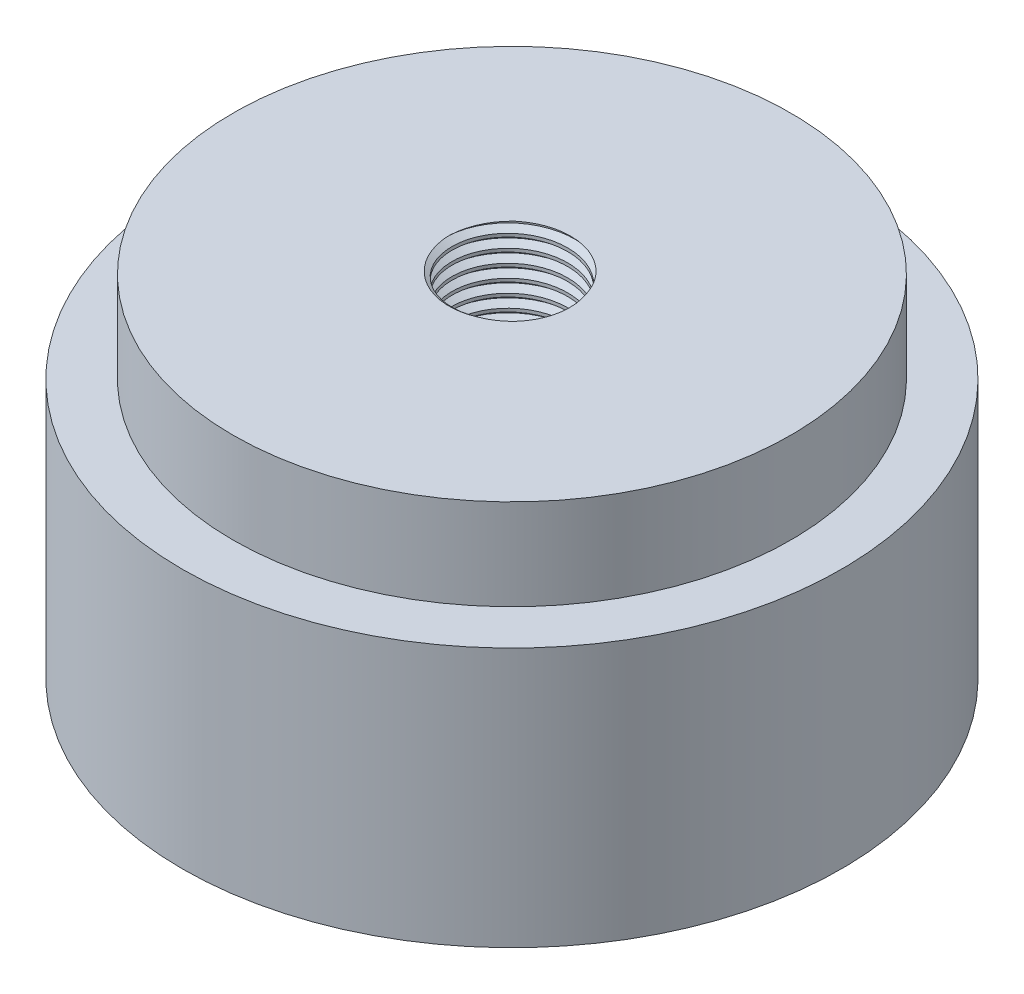
from build123d import *

# Parameters (mm, degrees)
SKETCH1_R           = 21.5
BOSS_EXTRUDE1_DEPTH = 27
SKETCH1_3_R         = 25.4
SKETCH1_3_R_2       = 21.5
BOSS_EXTRUDE2_DEPTH = 20
SKETCH3_R           = 5
CUT_EXTRUDE1_DEPTH  = 45.936844571
THREAD1_PITCH       = 1


with BuildPart() as part:
    # Sketch1 → Boss-Extrude1 (new body)
    with BuildSketch(Plane(origin=(0, 0, 0), x_dir=(1, 0, 0), z_dir=(0, 1, 0))):
        with Locations(Location((0, 0, 0), (0, 0, 270))):
            Circle(SKETCH1_R)
    extrude(amount=BOSS_EXTRUDE1_DEPTH)

    # Sketch1<3> → Boss-Extrude2 (add)
    with BuildSketch(Plane(origin=(0, 0, 0), x_dir=(1, 0, 0), z_dir=(0, 1, 0))):
        with Locations(Location((0, 0, 0), (0, 0, 270))):
            Circle(SKETCH1_3_R)
        with Locations(Location((0, 0, 0), (0, 0, 270))):
            Circle(SKETCH1_3_R_2, mode=Mode.SUBTRACT)
    extrude(amount=BOSS_EXTRUDE2_DEPTH)

    # Sketch3 → Cut-Extrude1 (cut, through all)
    with BuildSketch(Plane(origin=(0, 27, 0), x_dir=(1, 0, 0), z_dir=(0, 1, 0))):
        with Locations(Location((0, 0, 0), (0, 0, 270))):
            Circle(SKETCH3_R)
    extrude(amount=-CUT_EXTRUDE1_DEPTH, mode=Mode.SUBTRACT)

    # Thread1: arcs per turn and ends read off the stored shape
    # Thread1: the profile of Thread Profile1 profile screwed along a right-hand helix through 29 turns, 8 arcs to a turn; built about Z, then put on its axis
    thread1_z = Axis((0, 0, 0), (0, 0, 1))
    thread1_corners = [(5.0003, -1e-09, -0.000173205), (5.0003, -1e-09, 0.875173202), (4.458734125, -1e-09, 0.562499999), (4.458734125, -1e-09, 0.312499999)]
    with BuildLine(mode=Mode.PRIVATE) as thread1_profile:
        Line(thread1_corners[0], thread1_corners[1])
        Line(thread1_corners[1], thread1_corners[2])
        Line(thread1_corners[2], thread1_corners[3])
        Line(thread1_corners[3], thread1_corners[0])
    thread1_cap = Face(thread1_profile.wire())
    thread1_turn_angles = [0, 22.5, 45, 67.5, 90, 112.5, 135, 157.5, 180, 202.5, 225, 247.5, 270, 292.5, 315, 337.5, 360]
    thread1_turn_weights = [1, 0.9238795325112867, 1, 0.9238795325112867, 1, 0.9238795325112867, 1, 0.9238795325112867, 1, 0.9238795325112867, 1, 0.9238795325112867, 1, 0.9238795325112867, 1, 0.9238795325112867, 1]
    thread1_turn_rails = [Edge.make_bspline([Vector(p[0], p[1], 0).rotate(thread1_z, thread1_turn_angles[k]) / thread1_turn_weights[k] + Vector(0, 0, p[2] + THREAD1_PITCH * thread1_turn_angles[k] / 360) for k in range(17)], [0, 0, 0, 1, 1, 2, 2, 3, 3, 4, 4, 5, 5, 6, 6, 7, 7, 8, 8, 8], 2, thread1_turn_weights) for p in thread1_corners]
    thread1_turn_sides = [Face.make_surface_from_curves(thread1_turn_rails[p[0]], thread1_turn_rails[p[1]]) for p in [(0, 1), (1, 2), (2, 3), (3, 0)]]
    thread1 = Plane(origin=(0, 28, 0), x_dir=(-0.999390827, 0, -0.034899497), z_dir=(0, -1, 0)) * Solid(Shell([*[p.moved(Location((0, 0, THREAD1_PITCH * i))) for i in range(29) for p in thread1_turn_sides], thread1_cap, thread1_cap.rotate(thread1_z, 10440).moved(Location((0, 0, THREAD1_PITCH * 10440 / 360)))]))
    add(thread1)

    # SurfaceCut1
    split(bisect_by=Plane(origin=(0, 0, 0), x_dir=(1, 0, 0), z_dir=(0, 1, 0)), keep=Keep.TOP)

    # SurfaceCut2
    split(bisect_by=Plane(origin=(0, 27, 0), x_dir=(1, 0, 0), z_dir=(0, 1, 0)), keep=Keep.BOTTOM)


solid = part.part
